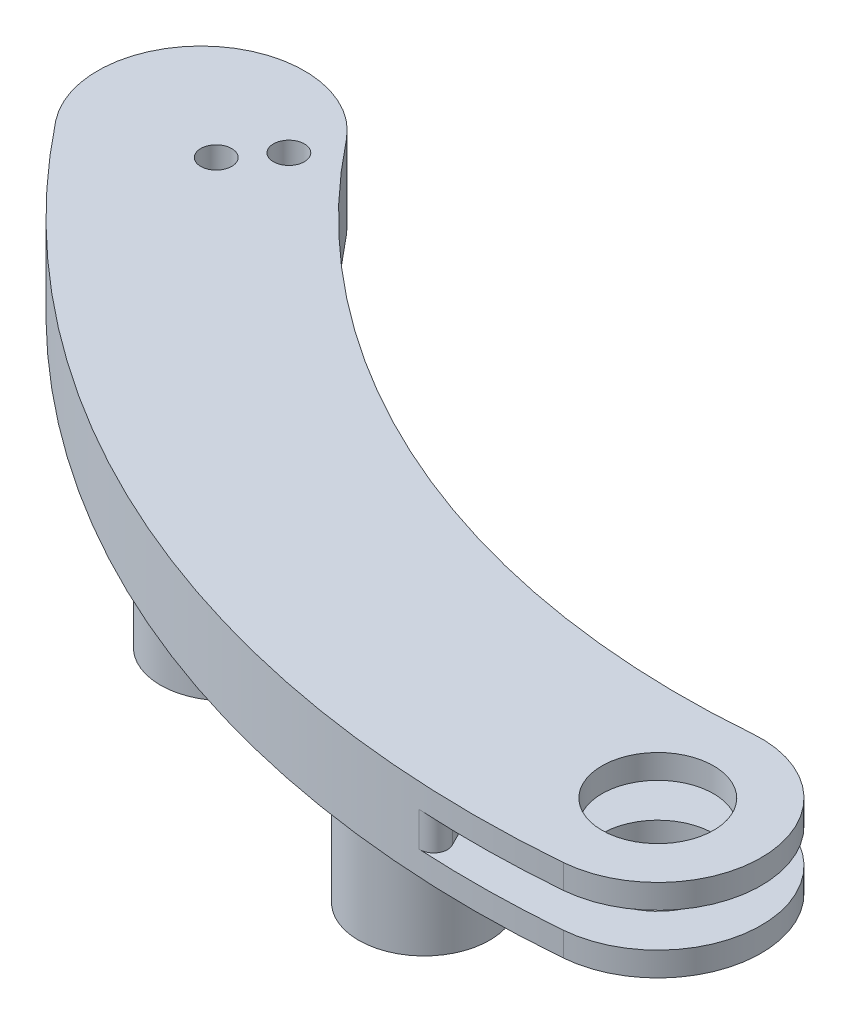
from build123d import *

# Parameters (mm, degrees)
BOSS_EXTRUDE4_DEPTH = 11.999999999999996
BOSS_EXTRUDE5_DEPTH = 3.5
BOSS_EXTRUDE6_DEPTH = 12
CUT_EXTRUDE2_DEPTH  = 8.5
BOSS_EXTRUDE7_DEPTH = 3.5000000000000004
SKETCH2_R           = 8.1
CUT_EXTRUDE3_DEPTH  = 12
FILLET1_R           = 5
FILLET2_R           = 2
SKETCH3_R           = 2.2499999999999964
CUT_EXTRUDE4_DEPTH  = 12
SKETCH4_R           = 9.500000000000002
SKETCH4_R_2         = 8.000000000000002
SKETCH4_R_3         = 9.499999999999995
SKETCH4_R_4         = 7.999999999999998
BOSS_EXTRUDE8_DEPTH = 20


with BuildPart() as part:
    # Sketch1 → Boss-Extrude4 (new body)
    with BuildSketch(Plane(origin=(0, 0, 0), x_dir=(1, 0, 0), z_dir=(0, 1, 0))):
        with BuildLine():
            ThreePointArc((-105.23956914411866, 60.05130546378884), (-126.31086817026393, 62.500868149406244), (-128.76043085588134, 41.429569123260976))
            ThreePointArc((-128.76043085588134, 41.42956912326096), (-78.3921989201775, 0.4513014224205847), (-15.424890802752289, -15.400995588922257))
            ThreePointArc((-15.424890802752284, -15.400995588922251), (-20.878753235246265, -0.5691494549701637), (-16.67921047602729, 14.665420305521598))
            ThreePointArc((-16.679210476027265, 14.665420305521593), (-65.8857769449076, 27.74562513419724), (-105.23956914411866, 60.05130546378885))
        make_face()
    extrude(amount=BOSS_EXTRUDE4_DEPTH)

    # Sketch1<6> → Boss-Extrude5 (add)
    with BuildSketch(Plane(origin=(0, 0, 0), x_dir=(1, 0, 0), z_dir=(0, 1, 0))):
        with BuildLine():
            ThreePointArc((-16.67921047602729, 14.665420305521598), (-20.878753235246265, -0.5691494549701637), (-15.424890802752284, -15.400995588922251))
            ThreePointArc((-15.424890802752289, -15.400995588922257), (-7.086372530747029, -15.406529466177687), (1.2395691441186596, -14.94869453621115))
            ThreePointArc((1.2395691441186607, -14.948694536211157), (14.948694536211152, 1.2395691441186514), (-1.2395691441186483, 14.948694536211152))
            ThreePointArc((-1.2395691441186347, 14.94869453621115), (-8.954828429393212, 14.55844291928571), (-16.679210476027265, 14.665420305521593))
        make_face()
    extrude(amount=BOSS_EXTRUDE5_DEPTH)

    # Sketch1<8> → Boss-Extrude6 (add)
    with BuildSketch(Plane(origin=(0, 0, 0), x_dir=(1, 0, 0), z_dir=(0, 1, 0))):
        with BuildLine():
            ThreePointArc((-16.67921047602729, 14.665420305521598), (-20.878753235246265, -0.5691494549701637), (-15.424890802752284, -15.400995588922251))
            ThreePointArc((-15.424890802752289, -15.400995588922257), (-7.086372530747029, -15.406529466177687), (1.2395691441186596, -14.94869453621115))
            ThreePointArc((1.2395691441186607, -14.948694536211157), (14.948694536211152, 1.2395691441186514), (-1.2395691441186483, 14.948694536211152))
            ThreePointArc((-1.2395691441186347, 14.94869453621115), (-8.954828429393212, 14.55844291928571), (-16.679210476027265, 14.665420305521593))
        make_face()
    extrude(amount=BOSS_EXTRUDE6_DEPTH)

    # Sketch1<9> → Cut-Extrude2 (cut)
    with BuildSketch(Plane(origin=(0, 0, 0), x_dir=(1, 0, 0), z_dir=(0, 1, 0))):
        with BuildLine():
            ThreePointArc((-16.67921047602729, 14.665420305521598), (-20.878753235246265, -0.5691494549701637), (-15.424890802752284, -15.400995588922251))
            ThreePointArc((-15.424890802752289, -15.400995588922257), (-7.086372530747029, -15.406529466177687), (1.2395691441186596, -14.94869453621115))
            ThreePointArc((1.2395691441186607, -14.948694536211157), (14.948694536211152, 1.2395691441186514), (-1.2395691441186483, 14.948694536211152))
            ThreePointArc((-1.2395691441186347, 14.94869453621115), (-8.954828429393212, 14.55844291928571), (-16.679210476027265, 14.665420305521593))
        make_face()
    extrude(amount=CUT_EXTRUDE2_DEPTH, mode=Mode.SUBTRACT)

    # Sketch1<10> → Boss-Extrude7 (add)
    with BuildSketch(Plane(origin=(0, 0, 0), x_dir=(1, 0, 0), z_dir=(0, 1, 0))):
        with BuildLine():
            ThreePointArc((-16.67921047602729, 14.665420305521598), (-20.878753235246265, -0.5691494549701637), (-15.424890802752284, -15.400995588922251))
            ThreePointArc((-15.424890802752289, -15.400995588922257), (-7.086372530747029, -15.406529466177687), (1.2395691441186596, -14.94869453621115))
            ThreePointArc((1.2395691441186607, -14.948694536211157), (14.948694536211152, 1.2395691441186514), (-1.2395691441186483, 14.948694536211152))
            ThreePointArc((-1.2395691441186347, 14.94869453621115), (-8.954828429393212, 14.55844291928571), (-16.679210476027265, 14.665420305521593))
        make_face()
    extrude(amount=BOSS_EXTRUDE7_DEPTH)

    # Sketch2 → Cut-Extrude3 (cut)
    with BuildSketch(Plane(origin=(0, 11.999999999999996, 0), x_dir=(1, 0, 0), z_dir=(0, 1, 0))):
        Circle(SKETCH2_R)
    extrude(amount=-CUT_EXTRUDE3_DEPTH, mode=Mode.SUBTRACT)

    # Fillet1
    fillet1_edges = [part.edges().sort_by_distance(p)[0] for p in [
        (-16.67921047602728, 6, -14.665420305521597),
    ]]
    fillet(fillet1_edges, radius=FILLET1_R)

    # Fillet2
    fillet2_edges = [part.edges().sort_by_distance(p)[0] for p in [
        (-15.424890802752289, 6, 15.400995588922266),
    ]]
    fillet(fillet2_edges, radius=FILLET2_R)

    # Sketch3 → Cut-Extrude4 (cut)
    with BuildSketch(Plane(origin=(0, 11.999999999999996, 0), x_dir=(1, 0, 0), z_dir=(0, 1, 0))):
        with Locations((-107.81660725396851, 54.30249040498051)):
            Circle(SKETCH3_R)
        with Locations((-112.49908312253997, 48.44378579216329)):
            Circle(SKETCH3_R)
    extrude(amount=-CUT_EXTRUDE4_DEPTH, mode=Mode.SUBTRACT)

    # Sketch4 → Boss-Extrude8 (add)
    # profile 1 of 2: a face of its own
    with BuildSketch(Plane(origin=(0, 0, 0), x_dir=(1, 0, 0), z_dir=(0, 1, 0))):
        with Locations((-35.824132830362714, 1.9278264844930209)):
            Circle(SKETCH4_R)
        with Locations((-35.824132830362714, 1.9278264844930209)):
            Circle(SKETCH4_R_2, mode=Mode.SUBTRACT)
    # profile 2 of 2: a face of its own
    with BuildSketch(Plane(origin=(0, 0, 0), x_dir=(1, 0, 0), z_dir=(0, 1, 0))):
        with Locations((-82.24716798080135, 19.60428986869888)):
            Circle(SKETCH4_R_3)
        with Locations((-82.24716798080135, 19.60428986869888)):
            Circle(SKETCH4_R_4, mode=Mode.SUBTRACT)
    extrude(amount=-BOSS_EXTRUDE8_DEPTH)


solid = part.part
